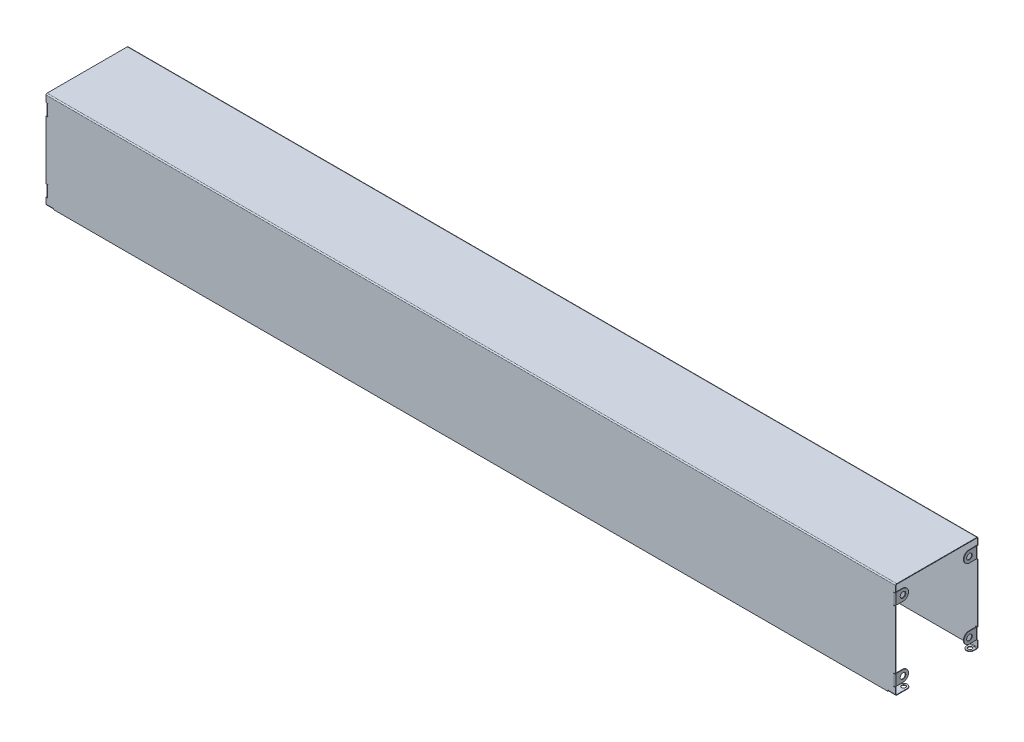
from build123d import *

# Parameters (mm, degrees)
T_LE_DE_BASE_PLI_E1_DEPTH              = 575
T_LE_PLI_E_SUR_AR_TE2_STRIP_W          = 4.4196
T_LE_PLI_E_SUR_AR_TE2_STRIP_H          = 0.7366
T_LE_PLI_E_SUR_AR_TE2_STRIP_CUT_DEPTH  = 10
T_LE_PLI_E_SUR_AR_TE2_RELIEF_W         = 4.7879
T_LE_PLI_E_SUR_AR_TE2_RELIEF_H         = 0.3683
T_LE_PLI_E_SUR_AR_TE2_RELIEF_CUT_DEPTH = 0.7366
T_LE_PLI_E_SUR_AR_TE2_DEPTH            = 10
T_LE_PLI_E_SUR_AR_TE2_FLAT_DEPTH       = 0.7366
T_LE_PLI_E_SUR_AR_TE3_STRIP_W          = 4.4196
T_LE_PLI_E_SUR_AR_TE3_STRIP_H          = 0.7366
T_LE_PLI_E_SUR_AR_TE3_STRIP_CUT_DEPTH  = 10
T_LE_PLI_E_SUR_AR_TE3_RELIEF_W         = 4.7879
T_LE_PLI_E_SUR_AR_TE3_RELIEF_H         = 0.3683
T_LE_PLI_E_SUR_AR_TE3_RELIEF_CUT_DEPTH = 0.7366
T_LE_PLI_E_SUR_AR_TE3_DEPTH            = 10
T_LE_PLI_E_SUR_AR_TE3_FLAT_DEPTH       = 0.7366
T_LE_PLI_E_SUR_AR_TE5_STRIP_W          = 5.2196
T_LE_PLI_E_SUR_AR_TE5_STRIP_H          = 0.7366
T_LE_PLI_E_SUR_AR_TE5_STRIP_CUT_DEPTH  = 15
T_LE_PLI_E_SUR_AR_TE5_RELIEF_W         = 5.5879
T_LE_PLI_E_SUR_AR_TE5_RELIEF_H         = 0.3683
T_LE_PLI_E_SUR_AR_TE5_RELIEF_CUT_DEPTH = 0.7366
T_LE_PLI_E_SUR_AR_TE5_DEPTH            = 15
T_LE_PLI_E_SUR_AR_TE5_FLAT_DEPTH       = 0.7366
PER_AGE1_START                         = -65
PER_AGE1_OUTLINE_R                     = 2.75
PER_AGE1_DEPTH                         = 0.7366
PER_AGE2_START                         = -65
PER_AGE2_OUTLINE_R                     = 2.75
PER_AGE2_DEPTH                         = 0.7366
PER_AGE3_START                         = 573.4634
PER_AGE3_OUTLINE_R                     = 3.8
PER_AGE3_DEPTH                         = 0.7366
SYM_TRIE9_COPY_1_SKETCH_W              = 5.2196
SYM_TRIE9_COPY_1_SKETCH_H              = 0.7366
SYM_TRIE9_COPY_1_DEPTH                 = 15
SYM_TRIE9_COPY_2_SKETCH_W              = 5.5879
SYM_TRIE9_COPY_2_SKETCH_H              = 0.3683
SYM_TRIE9_COPY_2_DEPTH                 = 0.7366
SYM_TRIE9_COPY_3_DEPTH                 = 15
SYM_TRIE9_COPY_4_DEPTH                 = 0.7366
SYM_TRIE9_START                        = 573.4634
SYM_TRIE9_COPY_5_SKETCH_R              = 3.8
SYM_TRIE9_COPY_5_DEPTH                 = 0.7366
D_GAGEMENT_M71_D                       = 7.6
D_GAGEMENT_M71_DEPTH                   = 0.7366


# Read off the part's stored shape, not the designer's step: Perçage1, Perçage2, Perçage3
# Sheet-metal steps are written as plain solids
with BuildPart() as part:
    # Esquisse1 → Tôle de base pliée1 (new body)
    with BuildSketch(Plane(origin=(0, 0, 0), x_dir=(0, 0, -1), z_dir=(1, 0, 0))):
        with BuildLine():
            Line((-55, -65), (-55, 64.2634))
            ThreePointArc((-55, 64.2634), (-54.784254855, 64.784254855), (-54.2634, 65))
            Line((-54.2634, 65), (54.2634, 65))
            ThreePointArc((54.2634, 65), (54.784254855, 64.784254855), (55, 64.2634))
            Line((55, 64.2634), (55, -65))
            Line((55, -65), (55.7366, -65))
            Line((55.7366, -65), (55.7366, 64.2634))
            ThreePointArc((55.7366, 64.2634), (55.30510971, 65.30510971), (54.2634, 65.7366))
            Line((54.2634, 65.7366), (-54.2634, 65.7366))
            ThreePointArc((-54.2634, 65.7366), (-55.30510971, 65.30510971), (-55.7366, 64.2634))
            Line((-55.7366, 64.2634), (-55.7366, -65))
            Line((-55.7366, -65), (-55, -65))
        make_face()
    extrude(amount=T_LE_DE_BASE_PLI_E1_DEPTH)

    # Tôle pliée sur arête2 strip (across the edge) → Tôle pliée sur arête2 strip cut (cut)
    with BuildSketch(Plane(origin=(575, -65, 55), x_dir=(0, 1, 0), z_dir=(-1, 0, 0))):
        with Locations((-0.7366, -0.3683)):
            Rectangle(T_LE_PLI_E_SUR_AR_TE2_STRIP_W, T_LE_PLI_E_SUR_AR_TE2_STRIP_H)
    extrude(amount=T_LE_PLI_E_SUR_AR_TE2_STRIP_CUT_DEPTH, mode=Mode.SUBTRACT)

    # Tôle pliée sur arête2 relief (on the sheet) → Tôle pliée sur arête2 relief cut (cut)
    with BuildSketch(Plane(origin=(575, -63.5268, 55), x_dir=(0, 1, 0), z_dir=(0, 0, -1))):
        with Locations((-2.02565, -10.18415)):
            Rectangle(T_LE_PLI_E_SUR_AR_TE2_RELIEF_W, T_LE_PLI_E_SUR_AR_TE2_RELIEF_H)
    extrude(amount=-T_LE_PLI_E_SUR_AR_TE2_RELIEF_CUT_DEPTH, mode=Mode.SUBTRACT)

    # Tôle pliée sur arête2 bend section (across the edge) → Tôle pliée sur arête2 (add)
    with BuildSketch(Plane(origin=(575, -65, 55), x_dir=(0, 1, 0), z_dir=(-1, 0, 0))):
        with BuildLine():
            Line((0, 0.7366), (0.7366, 0.7366))
            ThreePointArc((0.7366, 0.7366), (0.952345145, 0.215745145), (1.4732, 0))
            Line((1.4732, 0), (1.4732, -0.7366))
            ThreePointArc((1.4732, -0.7366), (0.43149029, -0.30510971), (0, 0.7366))
        make_face()
    extrude(amount=T_LE_PLI_E_SUR_AR_TE2_DEPTH)

    # Tôle pliée sur arête2 profile (on flange) → Tôle pliée sur arête2 flat (add)
    with BuildSketch(Plane(origin=(0, -65, 55), x_dir=(-1, 0, 0), z_dir=(0, -1, 0))):
        with BuildLine():
            Line((-575, 15), (-575, 0.7366))
            Line((-575, 0.7366), (-565, 0.7366))
            Line((-565, 0.7366), (-565, 15))
            ThreePointArc((-565, 15), (-570, 20), (-575, 15))
        make_face()
    extrude(amount=-T_LE_PLI_E_SUR_AR_TE2_FLAT_DEPTH)

    # Tôle pliée sur arête3 strip (across the edge) → Tôle pliée sur arête3 strip cut (cut)
    with BuildSketch(Plane(origin=(565, -65, -55), x_dir=(0, 1, 0), z_dir=(1, 0, 0))):
        with Locations((-0.7366, -0.3683)):
            Rectangle(T_LE_PLI_E_SUR_AR_TE3_STRIP_W, T_LE_PLI_E_SUR_AR_TE3_STRIP_H)
    extrude(amount=T_LE_PLI_E_SUR_AR_TE3_STRIP_CUT_DEPTH, mode=Mode.SUBTRACT)

    # Tôle pliée sur arête3 relief (on the sheet) → Tôle pliée sur arête3 relief cut (cut)
    with BuildSketch(Plane(origin=(565, -63.5268, -55), x_dir=(0, 1, 0), z_dir=(0, 0, 1))):
        with Locations((-2.02565, 0.18415)):
            Rectangle(T_LE_PLI_E_SUR_AR_TE3_RELIEF_W, T_LE_PLI_E_SUR_AR_TE3_RELIEF_H)
    extrude(amount=-T_LE_PLI_E_SUR_AR_TE3_RELIEF_CUT_DEPTH, mode=Mode.SUBTRACT)

    # Tôle pliée sur arête3 bend section (across the edge) → Tôle pliée sur arête3 (add)
    with BuildSketch(Plane(origin=(565, -65, -55), x_dir=(0, 1, 0), z_dir=(1, 0, 0))):
        with BuildLine():
            Line((0, 0.7366), (0.7366, 0.7366))
            ThreePointArc((0.7366, 0.7366), (0.952345145, 0.215745145), (1.4732, 0))
            Line((1.4732, 0), (1.4732, -0.7366))
            ThreePointArc((1.4732, -0.7366), (0.43149029, -0.30510971), (0, 0.7366))
        make_face()
    extrude(amount=T_LE_PLI_E_SUR_AR_TE3_DEPTH)

    # Tôle pliée sur arête3 profile (on flange) → Tôle pliée sur arête3 flat (add)
    with BuildSketch(Plane(origin=(0, -65, -55), x_dir=(1, 0, 0), z_dir=(0, -1, 0))):
        with BuildLine():
            Line((565, 0.7366), (575, 0.7366))
            Line((575, 0.7366), (575, 5))
            ThreePointArc((575, 5), (570, 10), (565, 5))
            Line((565, 5), (565, 0.7366))
        make_face()
    extrude(amount=-T_LE_PLI_E_SUR_AR_TE3_FLAT_DEPTH)

    # Tôle pliée sur arête5 strip (across the edge) → Tôle pliée sur arête5 strip cut (cut)
    with BuildSketch(Plane(origin=(574.2, 40, -55), x_dir=(-1, 0, 0), z_dir=(0, 1, 0))):
        with Locations((-1.1366, -0.3683)):
            Rectangle(T_LE_PLI_E_SUR_AR_TE5_STRIP_W, T_LE_PLI_E_SUR_AR_TE5_STRIP_H)
    t_le_pli_e_sur_ar_te5_strip_cut = extrude(amount=T_LE_PLI_E_SUR_AR_TE5_STRIP_CUT_DEPTH, mode=Mode.SUBTRACT)

    # Tôle pliée sur arête5 relief (on the sheet) → Tôle pliée sur arête5 relief cut (cut)
    with BuildSketch(Plane(origin=(572.7268, 40, -55), x_dir=(-1, 0, 0), z_dir=(0, 0, 1))):
        with Locations((-2.42565, 0.18415)):
            Rectangle(T_LE_PLI_E_SUR_AR_TE5_RELIEF_W, T_LE_PLI_E_SUR_AR_TE5_RELIEF_H)
        with Locations((-2.42565, -15.18415)):
            Rectangle(T_LE_PLI_E_SUR_AR_TE5_RELIEF_W, T_LE_PLI_E_SUR_AR_TE5_RELIEF_H)
    t_le_pli_e_sur_ar_te5_relief_cut = extrude(amount=-T_LE_PLI_E_SUR_AR_TE5_RELIEF_CUT_DEPTH, mode=Mode.SUBTRACT)

    # Tôle pliée sur arête5 bend section (across the edge) → Tôle pliée sur arête5 (add)
    with BuildSketch(Plane(origin=(574.2, 40, -55), x_dir=(-1, 0, 0), z_dir=(0, 1, 0))):
        with BuildLine():
            Line((0, 0.7366), (0.7366, 0.7366))
            ThreePointArc((0.7366, 0.7366), (0.952345145, 0.215745145), (1.4732, 0))
            Line((1.4732, 0), (1.4732, -0.7366))
            ThreePointArc((1.4732, -0.7366), (0.43149029, -0.30510971), (0, 0.7366))
        make_face()
    t_le_pli_e_sur_ar_te5 = extrude(amount=T_LE_PLI_E_SUR_AR_TE5_DEPTH)

    # Tôle pliée sur arête5 profile (on flange) → Tôle pliée sur arête5 flat (add)
    with BuildSketch(Plane(origin=(574.2, 0, -55), x_dir=(0, 1, 0), z_dir=(1, 0, 0))):
        with BuildLine():
            ThreePointArc((55, 10), (47.5, 17.5), (40, 10))
            Line((40, 10), (40, 0.7366))
            Line((40, 0.7366), (55, 0.7366))
            Line((55, 0.7366), (55, 10))
        make_face()
    t_le_pli_e_sur_ar_te5_flat = extrude(amount=-T_LE_PLI_E_SUR_AR_TE5_FLAT_DEPTH)

    # Perçage1 outline → Perçage1 (cut)
    with BuildSketch(Plane(origin=(0, 0, 0), x_dir=(1, 0, 0), z_dir=(0, 1, 0)).offset(PER_AGE1_START)):
        with Locations((570, 50)):
            Circle(PER_AGE1_OUTLINE_R)
    extrude(amount=PER_AGE1_DEPTH, mode=Mode.SUBTRACT)

    # Perçage2 outline → Perçage2 (cut)
    with BuildSketch(Plane(origin=(0, 0, 0), x_dir=(1, 0, 0), z_dir=(0, 1, 0)).offset(PER_AGE2_START)):
        with Locations((570, -40)):
            Circle(PER_AGE2_OUTLINE_R)
    extrude(amount=PER_AGE2_DEPTH, mode=Mode.SUBTRACT)

    # Perçage3 outline → Perçage3 (cut)
    with BuildSketch(Plane.YZ.offset(PER_AGE3_START)):
        with Locations((47.5, -45)):
            Circle(PER_AGE3_OUTLINE_R)
    per_age3 = extrude(amount=PER_AGE3_DEPTH, mode=Mode.SUBTRACT)

    # Symétrie8: Tôle pliée sur arête5 strip cut, Tôle pliée sur arête5 relief cut, Tôle pliée sur arête5, Tôle pliée sur arête5 flat, Perçage3 across plane
    add(t_le_pli_e_sur_ar_te5_strip_cut.mirror(Plane.ZX), mode=Mode.SUBTRACT)
    add(t_le_pli_e_sur_ar_te5_relief_cut.mirror(Plane.ZX), mode=Mode.SUBTRACT)
    add(t_le_pli_e_sur_ar_te5.mirror(Plane.ZX))
    add(t_le_pli_e_sur_ar_te5_flat.mirror(Plane.ZX))
    add(per_age3.mirror(Plane.ZX), mode=Mode.SUBTRACT)

    # Symétrie9: Tôle pliée sur arête5 strip cut, Tôle pliée sur arête5 relief cut, Tôle pliée sur arête5, Tôle pliée sur arête5 flat, Perçage3 across plane
    add(t_le_pli_e_sur_ar_te5_strip_cut.mirror(Plane.XY), mode=Mode.SUBTRACT)
    add(t_le_pli_e_sur_ar_te5_relief_cut.mirror(Plane.XY), mode=Mode.SUBTRACT)
    add(t_le_pli_e_sur_ar_te5.mirror(Plane.XY))
    add(t_le_pli_e_sur_ar_te5_flat.mirror(Plane.XY))
    add(per_age3.mirror(Plane.XY), mode=Mode.SUBTRACT)

    # Symétrie9 copy 1 sketch → Symétrie9 copy 1 (cut)
    with BuildSketch(Plane(origin=(574.2, -40, 55), x_dir=(-1, 0, 0), z_dir=(0, -1, 0))):
        with Locations((-1.1366, -0.3683)):
            Rectangle(SYM_TRIE9_COPY_1_SKETCH_W, SYM_TRIE9_COPY_1_SKETCH_H)
    extrude(amount=SYM_TRIE9_COPY_1_DEPTH, mode=Mode.SUBTRACT)

    # Symétrie9 copy 2 sketch → Symétrie9 copy 2 (cut)
    with BuildSketch(Plane(origin=(572.7268, -40, 55), x_dir=(-1, 0, 0), z_dir=(0, 0, -1))):
        with Locations((-2.42565, 0.18415)):
            Rectangle(SYM_TRIE9_COPY_2_SKETCH_W, SYM_TRIE9_COPY_2_SKETCH_H)
        with Locations((-2.42565, -15.18415)):
            Rectangle(SYM_TRIE9_COPY_2_SKETCH_W, SYM_TRIE9_COPY_2_SKETCH_H)
    extrude(amount=-SYM_TRIE9_COPY_2_DEPTH, mode=Mode.SUBTRACT)

    # Symétrie9 copy 3 sketch → Symétrie9 copy 3 (add)
    with BuildSketch(Plane(origin=(574.2, -40, 55), x_dir=(-1, 0, 0), z_dir=(0, -1, 0))):
        with BuildLine():
            Line((0, 0.7366), (0.7366, 0.7366))
            ThreePointArc((0.7366, 0.7366), (0.952345145, 0.215745145), (1.4732, 0))
            Line((1.4732, 0), (1.4732, -0.7366))
            ThreePointArc((1.4732, -0.7366), (0.43149029, -0.30510971), (0, 0.7366))
        make_face()
    extrude(amount=SYM_TRIE9_COPY_3_DEPTH)

    # Symétrie9 copy 4 sketch → Symétrie9 copy 4 (add)
    with BuildSketch(Plane(origin=(574.2, 0, 55), x_dir=(0, -1, 0), z_dir=(1, 0, 0))):
        with BuildLine():
            ThreePointArc((55, 10), (47.5, 17.5), (40, 10))
            Line((40, 10), (40, 0.7366))
            Line((40, 0.7366), (55, 0.7366))
            Line((55, 0.7366), (55, 10))
        make_face()
    extrude(amount=-SYM_TRIE9_COPY_4_DEPTH)

    # Symétrie9 copy 5 sketch → Symétrie9 copy 5 (cut)
    with BuildSketch(Plane(origin=(0, 0, 0), x_dir=(0, -1, 0), z_dir=(1, 0, 0)).offset(SYM_TRIE9_START)):
        with Locations((47.5, -45)):
            Circle(SYM_TRIE9_COPY_5_SKETCH_R)
    extrude(amount=SYM_TRIE9_COPY_5_DEPTH, mode=Mode.SUBTRACT)

    # Symétrie10: part across plane


with BuildPart() as part_1:
    add(part.part)
    add(part.part.mirror(Plane(origin=(0, 65.7366, -54.2634), x_dir=(0, 0, 1), z_dir=(-1, 0, 0))))

    # Dégagement M71
    with Locations(Plane(origin=(0, 0, -55.7366), x_dir=(1, 0, 0), z_dir=(0, 0, -1))):
        with Locations((-412.75, -46.65), (-412.75, 36.25), (-265.75, -46.65), (-265.75, 36.25), (-137.25, -46.65), (-137.25, 36.25), (-27.25, -46.65), (-27.25, 36.25), (82.75, -46.65), (82.75, 36.25), (192.75, -46.65), (192.75, 36.25), (302.75, -46.65), (302.75, 36.25), (412.75, -46.65), (412.75, 36.25)):
            Hole(D_GAGEMENT_M71_D / 2, depth=D_GAGEMENT_M71_DEPTH)


solid = part_1.part
